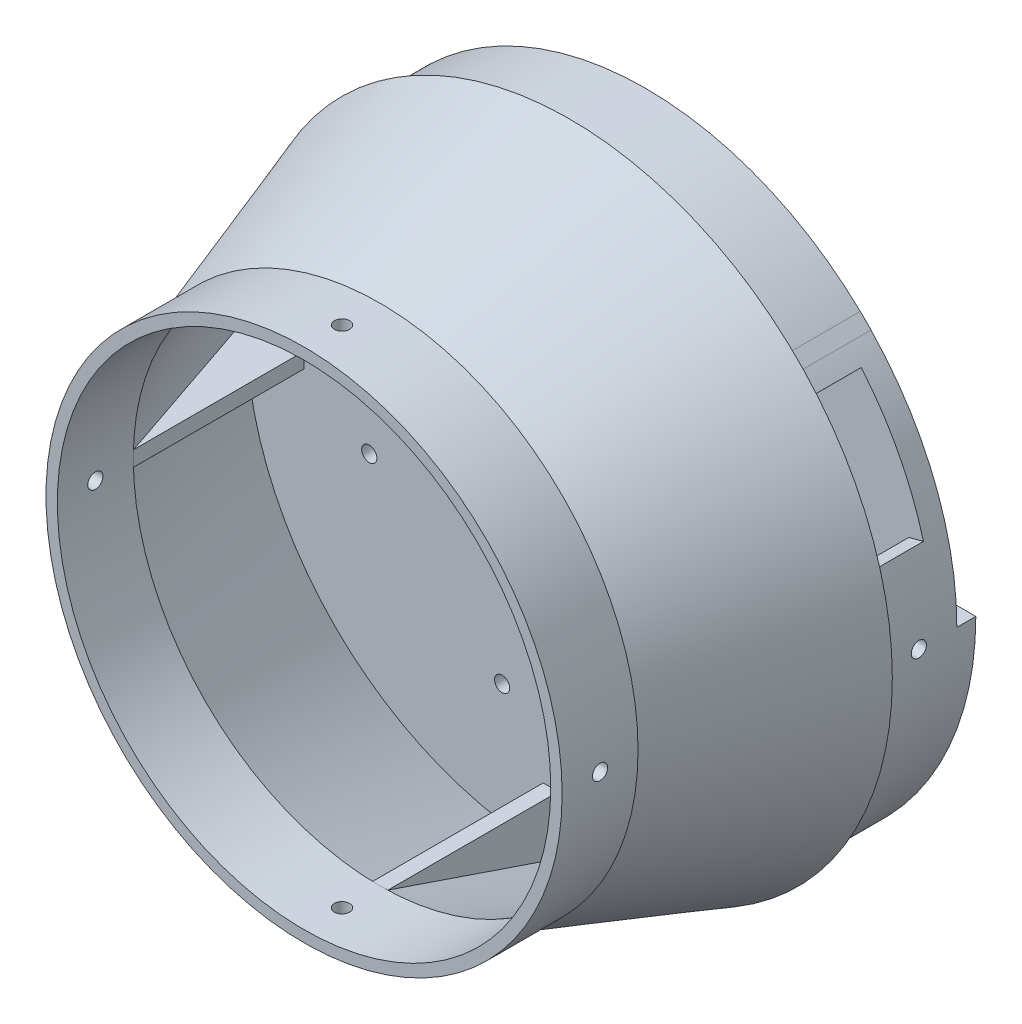
from build123d import *

# Parameters (mm, degrees)
BOSS_EXTRUDE5_DEPTH             = 2
CIRPATTERN3_COUNT               = 4
BOSS_EXTRUDE6_DEPTH             = 20
SKETCH14_R                      = 2
CUT_EXTRUDE1_DEPTH              = 95.00000000000004
CIRPATTERN4_COUNT               = 4
SKETCH16_R                      = 2.000000000000001
CUT_EXTRUDE2_DEPTH              = 94.00000000000004
CIRPATTERN5_COUNT               = 2
CIRPATTERN5_ANGLE               = 90.0000000000002
CIRPATTERN5_THE_OTHER_WAY_COUNT = 2
CIRPATTERN5_THE_OTHER_WAY_ANGLE = 90.0000000000002
SKETCH17_R                      = 2.0000000000000018
SKETCH17_R_2                    = 1.9999999999984424
SKETCH17_R_3                    = 1.9999999999962943
SKETCH17_R_4                    = 1.9999999999898757
CUT_EXTRUDE4_DEPTH              = 900
CUT_EXTRUDE7_START              = -20
CUT_EXTRUDE7_DEPTH              = 20
BOSS_EXTRUDE8_START             = -6
SKETCH22_R                      = 81.99999999999999
SKETCH22_R_2                    = 60
BOSS_EXTRUDE8_DEPTH             = 6
SKETCH24_R                      = 25
CUT_EXTRUDE8_DEPTH              = 5
SKETCH28_W                      = 13.999999999999986
SKETCH28_H                      = 19.999999999999986
BOSS_EXTRUDE9_DEPTH             = 2
CIRPATTERN6_COUNT               = 4
BOSS_EXTRUDE10_DEPTH            = 5
CUT_EXTRUDE11_DEPTH             = 10
CUT_EXTRUDE11_DEPTH_BACK        = 10
CUT_EXTRUDE12_START             = -10
CUT_EXTRUDE12_DEPTH             = 10


with BuildPart() as part:
    # Sketch10 → Revolve2 (revolve)
    with BuildSketch(Plane(origin=(0, 0, 0), x_dir=(1, 0, 0), z_dir=(0, 1, 0))):
        Polygon((68, 0), (84.99999999999999, 50.000000000000014), (0, 50), (6.1e-16, 44.99999999999999), (80.29999999999998, 44.999999999999986), (65, -5.63e-15), (65, -20), (68, -20), align=None)
    revolve(axis=Axis((0, 0, 0), (0, 0, -1)))

    # Sketch12 → Boss-Extrude5 (add, symmetric)
    with BuildSketch(Plane(origin=(0, 0, 0), x_dir=(1, 0, 0), z_dir=(0, 1, 0))):
        Polygon((-80.29999999999998, 44.999999999999986), (-65, -6.94e-15), (-65, 44.999999999999986), align=None)
    boss_extrude5 = extrude(amount=BOSS_EXTRUDE5_DEPTH, both=True)

    # CirPattern3: Boss-Extrude5 ×4 about axis
    cirpattern3_axis = Axis((0, 0, -50.000000000000014), (0, 0, 1))
    for i in range(1, CIRPATTERN3_COUNT):
        add(boss_extrude5.rotate(cirpattern3_axis, i * 360 / CIRPATTERN3_COUNT))

    # Sketch13 → Boss-Extrude6 (add)
    with BuildSketch(Plane(origin=(0, 0, -50.00000000000001), x_dir=(-1, 0, 0), z_dir=(0, 0, -1))):
        with BuildLine():
            ThreePointArc((81.99999999999999, 0), (78.94301742396219, 22.181073012818818), (70, 42.70831300812521))
            ThreePointArc((70.00000000000001, 42.70831300812522), (-82, -3.73e-14), (70.00000000000003, -42.70831300812524))
            ThreePointArc((70, -42.70831300812522), (78.94301742396219, -22.18107301281883), (81.99999999999999, -2.008e-14))
        make_face()
        with BuildLine():
            ThreePointArc((70.00000000000001, -34.40930106817047), (-77.99999999999999, -3.02e-14), (70, 34.40930106817045))
            ThreePointArc((70.00000000000001, 34.40930106817046), (75.97367965289031, 17.663521732655667), (78, 0))
            ThreePointArc((78, -1.91e-14), (75.97367965289031, -17.663521732655717), (70.00000000000001, -34.40930106817047))
        make_face(mode=Mode.SUBTRACT)
    extrude(amount=BOSS_EXTRUDE6_DEPTH)

    # Sketch14 → Cut-Extrude1 (cut)
    with BuildSketch(Plane(origin=(0, 0, 0), x_dir=(1, 0, 0), z_dir=(0, 1, 0))):
        with Locations((0, -10)):
            Circle(SKETCH14_R)
    cut_extrude1 = extrude(amount=-CUT_EXTRUDE1_DEPTH, mode=Mode.SUBTRACT)

    # CirPattern4: Cut-Extrude1 ×4 about axis
    cirpattern4_axis = Axis((0, 0, 20), (0, 0, 1))
    for i in range(1, CIRPATTERN4_COUNT):
        add(cut_extrude1.rotate(cirpattern4_axis, i * 360 / CIRPATTERN4_COUNT), mode=Mode.SUBTRACT)

    # Sketch16 → Cut-Extrude2 (cut)
    with BuildSketch(Plane(origin=(0, 0, 0), x_dir=(1, 0, 0), z_dir=(0, 1, 0))):
        with Locations((0, 60.00000000000002)):
            Circle(SKETCH16_R)
    cut_extrude2 = extrude(amount=-CUT_EXTRUDE2_DEPTH, mode=Mode.SUBTRACT)

    # CirPattern5: Cut-Extrude2 ×2 about axis
    cirpattern5_axis = Axis((0, 0, -70), (0, 0, -1))
    for i in range(1, CIRPATTERN5_COUNT):
        add(cut_extrude2.rotate(cirpattern5_axis, i * CIRPATTERN5_ANGLE / (CIRPATTERN5_COUNT - 1)), mode=Mode.SUBTRACT)

    # CirPattern5 the other way: Cut-Extrude2 ×2 about axis
    cirpattern5_the_other_way_axis = Axis((0, 0, -70), (0, 0, 1))
    for i in range(1, CIRPATTERN5_THE_OTHER_WAY_COUNT):
        add(cut_extrude2.rotate(cirpattern5_the_other_way_axis, i * CIRPATTERN5_THE_OTHER_WAY_ANGLE / (CIRPATTERN5_THE_OTHER_WAY_COUNT - 1)), mode=Mode.SUBTRACT)

    # Sketch17 → Cut-Extrude4 (cut)
    with BuildSketch(Plane(origin=(0, 0, -50.00000000000001), x_dir=(-1, 0, 0), z_dir=(0, 0, -1))):
        with Locations((-47.81332840130892, 12.811542732574635)):
            Circle(SKETCH17_R)
        with Locations((-12.811542732574251, 47.813328401310926)):
            Circle(SKETCH17_R_2)
        with Locations((12.811542732575758, -47.81332840131803)):
            Circle(SKETCH17_R_3)
        with Locations((47.81332840131364, -12.811542732584947)):
            Circle(SKETCH17_R_4)
    extrude(amount=-CUT_EXTRUDE4_DEPTH, mode=Mode.SUBTRACT)

    # Sketch19 → Cut-Extrude7 (cut)
    with BuildSketch(Plane(origin=(0, 0, -70), x_dir=(-1, 0, 0), z_dir=(0, 0, -1)).offset(CUT_EXTRUDE7_START)):
        with BuildLine():
            Line((0, 0), (-79.20591775570364, 21.223161698406447))
            ThreePointArc((-79.20591775570364, 21.223161698406447), (-72.73488832061426, 37.86338628527262), (-62.81564433575629, 52.70858399429611))
            Line((-62.81564433575629, 52.70858399429611), (0, 0))
        make_face()
    cut_extrude7 = extrude(amount=CUT_EXTRUDE7_DEPTH, mode=Mode.SUBTRACT)

    # Mirror1: Cut-Extrude7 across plane
    add(cut_extrude7.mirror(Plane(origin=(0, 0, 0), x_dir=(0, 0, 1), z_dir=(1, 0, 0))), mode=Mode.SUBTRACT)

    # Sketch22 → Boss-Extrude8 (add)
    with BuildSketch(Plane(origin=(0, 0, -70), x_dir=(-1, 0, 0), z_dir=(0, 0, -1)).offset(BOSS_EXTRUDE8_START)):
        Circle(SKETCH22_R)
        Circle(SKETCH22_R_2, mode=Mode.SUBTRACT)
    extrude(amount=BOSS_EXTRUDE8_DEPTH)

    # Sketch24 → Cut-Extrude8 (cut)
    with BuildSketch(Plane(origin=(0, 0, -50.00000000000001), x_dir=(-1, 0, 0), z_dir=(0, 0, -1))):
        Circle(SKETCH24_R)
    extrude(amount=-CUT_EXTRUDE8_DEPTH, mode=Mode.SUBTRACT)

    # Sketch28 → Boss-Extrude9 (add, symmetric)
    with BuildSketch(Plane(origin=(0, 0, 0), x_dir=(0.7071067811865477, 0.7071067811865475, 0), z_dir=(-0.7071067811865475, 0.7071067811865477, 0))):
        with Locations((-75, 60.00000000000001)):
            Rectangle(SKETCH28_W, SKETCH28_H)
    boss_extrude9 = extrude(amount=BOSS_EXTRUDE9_DEPTH, both=True)

    # CirPattern6: Boss-Extrude9 ×4 about axis
    cirpattern6_axis = Axis((0, 0, -70), (0, 0, -1))
    for i in range(1, CIRPATTERN6_COUNT):
        add(boss_extrude9.rotate(cirpattern6_axis, i * 360 / CIRPATTERN6_COUNT))

    # Sketch29 → Boss-Extrude10 (add)
    with BuildSketch(Plane(origin=(0, 0, -70), x_dir=(-1, 0, 0), z_dir=(0, 0, -1))):
        with BuildLine():
            Line((-75.00000000000001, -5.2372e-13), (-81.99999999999999, -3.9762e-13))
            ThreePointArc((-81.99999999999999, -3.9762e-13), (2.0531e-13, -81.99999999999999), (81.99999999999999, 0))
            Line((81.99999999999999, 0), (75.00000000000001, 0))
            ThreePointArc((75.00000000000001, 0), (2.5439e-13, -75.00000000000001), (-75.00000000000001, -5.2372e-13))
        make_face()
    extrude(amount=BOSS_EXTRUDE10_DEPTH)

    # Sketch30 → Cut-Extrude11 (cut, two sides: drawn at the far end of the back side and taken through both)
    with BuildSketch(Plane(origin=(0, 0, -50.00000000000001), x_dir=(-1, 0, 0), z_dir=(0, 0, -1)).offset(-CUT_EXTRUDE11_DEPTH_BACK)):
        with BuildLine():
            ThreePointArc((-69.41422607543288, 9.036881007775852), (-64.09208645048781, 28.146126810330443), (-53.623111018328565, 44.99513267805769))
            Line((-53.623111018328565, 44.99513267805769), (-58.98542212016139, 49.49464594586343))
            ThreePointArc((-58.985422120161395, 49.49464594586345), (-70.50129509553655, 30.96073949136347), (-76.35564868297614, 9.94056910855342))
            Line((-76.35564868297612, 9.940569108553424), (-69.41422607543286, 9.036881007775847))
        make_face()
    extrude(amount=CUT_EXTRUDE11_DEPTH + CUT_EXTRUDE11_DEPTH_BACK, mode=Mode.SUBTRACT)

    # Sketch30<5> → Cut-Extrude12 (cut)
    with BuildSketch(Plane(origin=(0, 0, -50.00000000000001), x_dir=(-1, 0, 0), z_dir=(0, 0, -1)).offset(CUT_EXTRUDE12_START)):
        with BuildLine():
            ThreePointArc((76.70699175306436, 6.7109921915700195), (71.13872400336902, 29.466624292112016), (58.98542212016139, 49.49464594586343))
            Line((58.98542212016139, 49.49464594586343), (53.62311101832856, 44.995132678057686))
            ThreePointArc((53.62311101832856, 44.995132678057686), (64.67156727579004, 26.787840265556376), (69.7336288664222, 6.100901992336384))
            Line((69.7336288664222, 6.100901992336384), (76.70699175306437, 6.7109921915700195))
        make_face()
    extrude(amount=CUT_EXTRUDE12_DEPTH, mode=Mode.SUBTRACT)


solid = part.part
